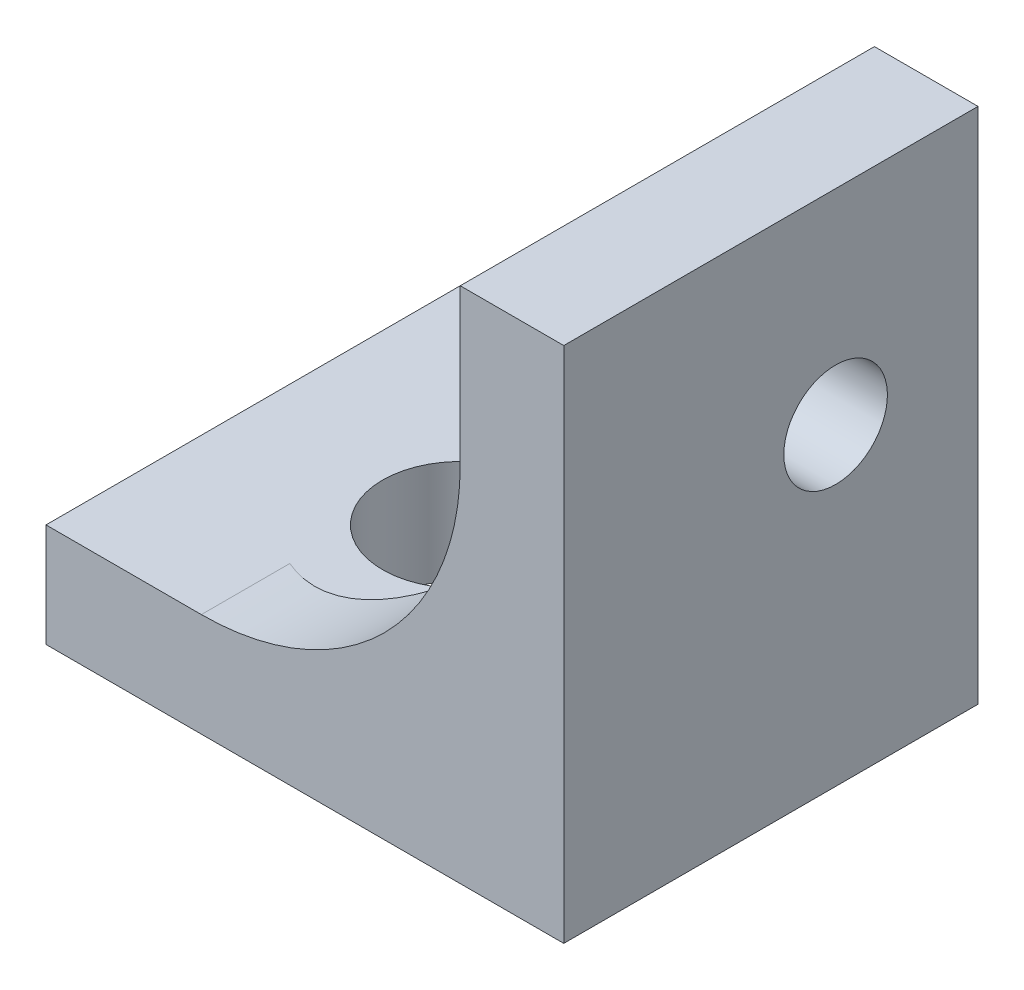
from build123d import *

# Parameters (mm, degrees)
BOSS_EXTRUDE1_DEPTH = 4
SKETCH2_R           = 1.5
CUT_EXTRUDE1_DEPTH  = 8
SKETCH3_R           = 1
CUT_EXTRUDE2_DEPTH  = 8
FILLET1_R           = 5
SKETCH4_R           = 2.5
CUT_EXTRUDE3_DEPTH  = 8
SKETCH5_R           = 1.75
CUT_EXTRUDE4_DEPTH  = 8


with BuildPart() as part:
    # Sketch1 → Boss-Extrude1 (new, symmetric)
    with BuildSketch(Plane.XY):
        Polygon((-10, 0), (0, 0), (0, 10), (-2, 10), (-2, 2), (-10, 2), align=None)
    extrude(amount=BOSS_EXTRUDE1_DEPTH, both=True)

    # Sketch2 → Cut-Extrude1 (cut)
    with BuildSketch(Plane(origin=(0, 2, 0), x_dir=(1, 0, 0), z_dir=(0, 1, 0))):
        with Locations(Location((-6, 0, 0), (0, 0, 180))):
            Circle(SKETCH2_R)
    extrude(amount=-CUT_EXTRUDE1_DEPTH, mode=Mode.SUBTRACT)

    # Sketch3 → Cut-Extrude2 (cut)
    with BuildSketch(Plane.ZY.offset(2)):
        with Locations(Location((-1.25, 6.05, 0), (0, 0, 270))):
            Circle(SKETCH3_R)
    extrude(amount=-CUT_EXTRUDE2_DEPTH, mode=Mode.SUBTRACT)

    # Fillet1
    # the kernel refuses this fillet: 5 mm, written as the material it adds along each edge
    with BuildSketch(Plane(origin=(-2, 2, 4), x_dir=(0, 1, 0), z_dir=(0, 0, -1))) as fillet1_piece_1_section:
        with BuildLine():
            CenterArc((FILLET1_R, -FILLET1_R), FILLET1_R, 90, 90)
            Line((0, -FILLET1_R), (0, 0))
            Line((0, 0), (FILLET1_R, 0))
        make_face()
    fillet1_piece_1 = extrude(amount=8, mode=Mode.PRIVATE)
    fillet1_piece_1 = fillet1_piece_1 - Plane(origin=(-6, 3.13209962, 0), x_dir=(-1, 0, 0), z_dir=(0, 1, 0)) * Cylinder(1.5, 36, mode=Mode.PRIVATE)
    fillet1_piece_1 = fillet1_piece_1 - Plane(origin=(-3.062165259, 6.05, -1.25), x_dir=(0, -1, 0), z_dir=(-1, 0, 0)) * Cylinder(1, 36, mode=Mode.PRIVATE)
    add(fillet1_piece_1)

    # Sketch4 → Cut-Extrude3 (cut)
    with BuildSketch(Plane(origin=(0, 2, 0), x_dir=(1, 0, 0), z_dir=(0, 1, 0))):
        with Locations((-6, 0)):
            Circle(SKETCH4_R)
    extrude(amount=CUT_EXTRUDE3_DEPTH, mode=Mode.SUBTRACT)

    # Sketch5 → Cut-Extrude4 (cut)
    with BuildSketch(Plane.ZY.offset(2)):
        with Locations((-1.25, 6.05)):
            Circle(SKETCH5_R)
    extrude(amount=CUT_EXTRUDE4_DEPTH, mode=Mode.SUBTRACT)


solid = part.part
